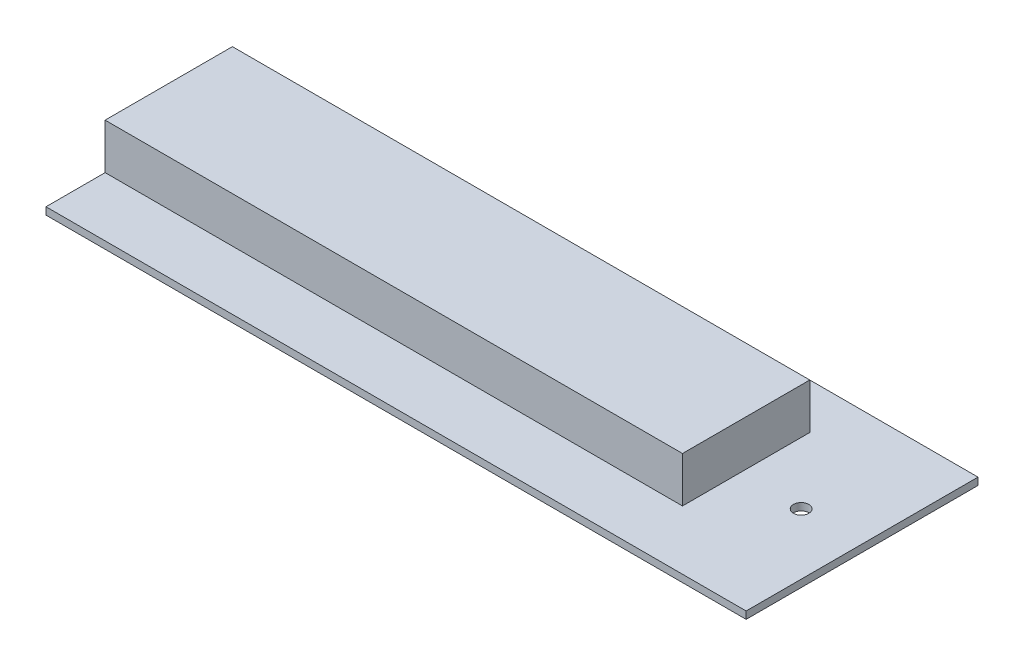
from build123d import *

# Parameters (mm, degrees)
SKETCH1_W           = 154
SKETCH1_H           = 51
SKETCH1_R           = 1.7
BOSS_EXTRUDE1_DEPTH = 1.6
SKETCH2_W           = 127
SKETCH2_H           = 28
BOSS_EXTRUDE2_DEPTH = 10


with BuildPart() as part:
    # Sketch1 → Boss-Extrude1 (new body)
    with BuildSketch(Plane(origin=(0, 0, 0), x_dir=(1, 0, 0), z_dir=(0, 1, 0))):
        with Locations((77, 25.5)):
            Rectangle(SKETCH1_W, SKETCH1_H)
        with Locations((77, 25.5)):
            Circle(SKETCH1_R, mode=Mode.SUBTRACT)
        with Locations((13.4, 25.5)):
            Circle(SKETCH1_R, mode=Mode.SUBTRACT)
        with Locations((140.6, 25.5)):
            Circle(SKETCH1_R, mode=Mode.SUBTRACT)
    extrude(amount=BOSS_EXTRUDE1_DEPTH)

    # Sketch2 → Boss-Extrude2 (add)
    with BuildSketch(Plane(origin=(0, 1.6, 0), x_dir=(1, 0, 0), z_dir=(0, 1, 0))):
        with Locations((63.5, 27)):
            Rectangle(SKETCH2_W, SKETCH2_H)
    extrude(amount=BOSS_EXTRUDE2_DEPTH)


solid = part.part
